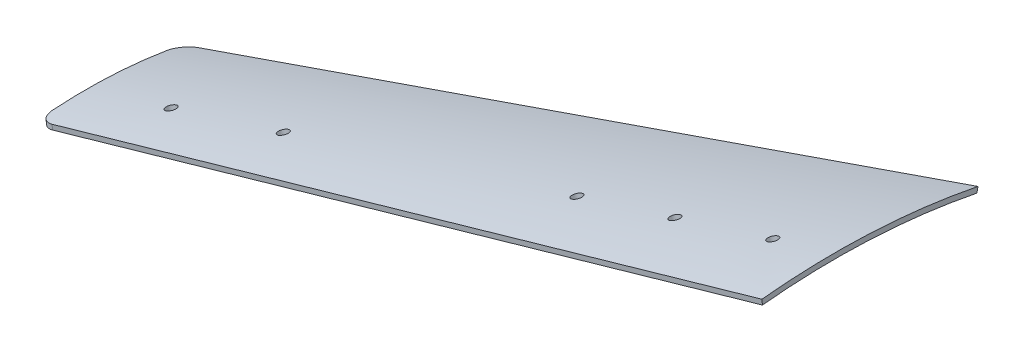
from build123d import *

# Parameters (mm, degrees)
REVOLVE1_ANGLE           = 11.5
REVOLVE1_OTHER_WAY_ANGLE = 6
MOVE_START               = -146.12
MOVE_FACE2_DEPTH         = 146.12
FILLET1_R                = 3
F_2_0_2_DIAMETER_HOLE1_D = 2


# Read off the part's stored shape, not the designer's step: Move Face2
with BuildPart() as part:
    # Sketch1 → Revolve1 (revolve)
    with BuildSketch(Plane.XY):
        Polygon((0, 140.9), (0, 141.95), (-146.12, 96.438688033), (-146.12, 95.388688033), align=None)
    revolve(axis=Axis((0, 0, 0), (-1, 0, 0)), revolution_arc=REVOLVE1_ANGLE)

    # Sketch1 → Revolve1 other way (revolve)
    with BuildSketch(Plane.XY):
        Polygon((0, 140.9), (0, 141.95), (-146.12, 96.438688033), (-146.12, 95.388688033), align=None)
    revolve(axis=Axis((0, 0, 0), (1, 0, 0)), revolution_arc=REVOLVE1_OTHER_WAY_ANGLE)

    # Move Face2 outline → Move Face2 (cut)
    with BuildSketch(Plane.YZ.offset(MOVE_START)):
        Polygon((143, -28.583435533), (139.199132872, -27.810140376), (93.572131782, -18.527222088), (92, -18.207368262), (92, -18.717611547), (93.473731945, -19.0174457), (139.100311821, -28.300278291), (143, -29.093678818), align=None)
        Polygon((141.223771509, 14.340462366), (143, 14.527151503), (143, 15.029905643), (141.172383048, 14.837815361), (94.866138819, 9.970832973), (92, 9.669589644), (92, 9.166835505), (94.917099792, 9.473435048), align=None)
    extrude(amount=MOVE_FACE2_DEPTH, mode=Mode.SUBTRACT)

    # Fillet1
    fillet1_edges = [part.edges().sort_by_distance(p)[0] for p in [
        (-146.12, 94.086599243, -18.631891676),
        (-146.12, 95.439230882, 9.528313237),
    ]]
    fillet(fillet1_edges, radius=FILLET1_R)

    # Ø2.0 (2) Diameter Hole1 (through all)
    with Locations(Plane(origin=(-40.302709805, 129.397103757, 0), x_dir=(-0.9547607995027982, -0.29737487407778324, 0), z_dir=(-0.29737487407778324, 0.9547607995027982, 0))):
        with Locations((-9.41, 0), (-29.41, 0), (10.59, 0), (70.59, 0), (93.501101925, 0)):
            Hole(F_2_0_2_DIAMETER_HOLE1_D / 2)


solid = part.part
